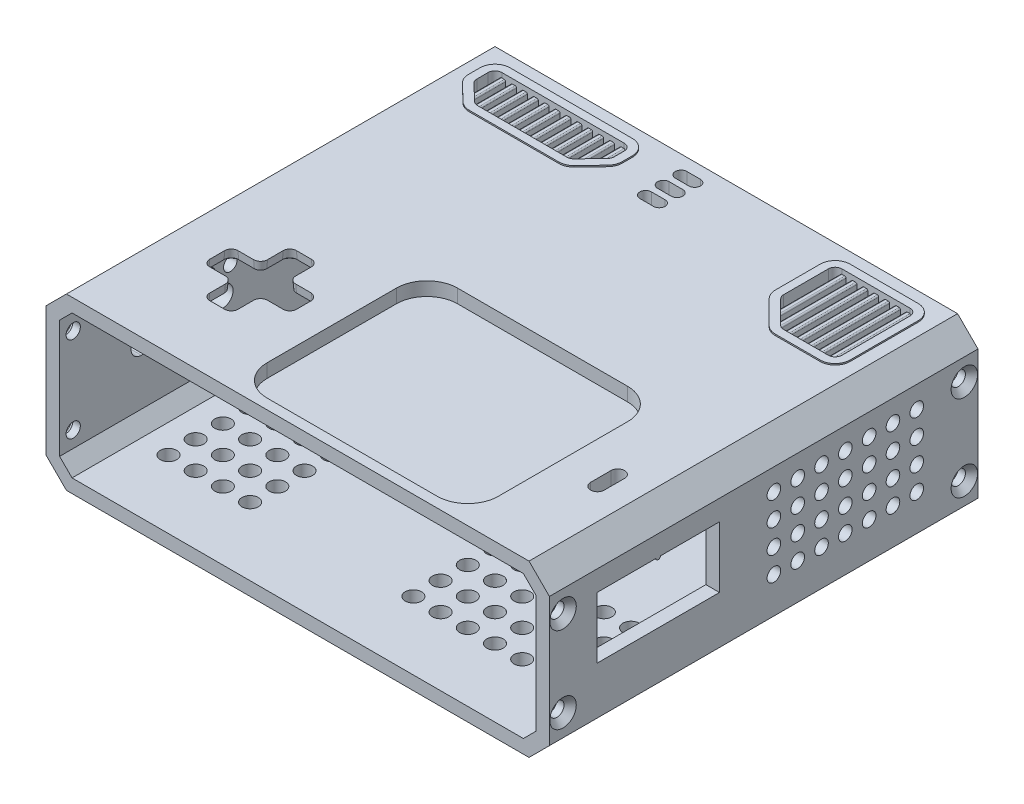
from build123d import *

# Parameters (mm, degrees)
SKETCH_1_W                         = 74
SKETCH_1_H                         = 63
EXTRUDE_1_DEPTH                    = 25
CHAMFER_1_SIZE                     = 3
CUT_EXTRUDE_1_DEPTH                = 78.238017391
CUT_EXTRUDE_2_REACH                = 67.167
SKETCH_6_R                         = 1.05
CUT_EXTRUDE_4_DEPTH                = 92.384239478
CHAMFER_2_SIZE                     = 0.9
CUT_EXTRUDE_5_REACH                = 67.167
CUT_EXTRUDE_6_REACH                = 93.384
CUT_EXTRUDE_7_REACH                = 93.384
SKETCH_9_W                         = 4
SKETCH_9_H                         = 2
FILLET_1_R                         = 1
SKETCH_10_R                        = 1
CUT_EXTRUDE_8_DEPTH                = 2
CUT_EXTRUDE_9_REACH                = 93.384
SKETCH_11_W                        = 18
SKETCH_11_H                        = 9
SKETCH_12_W                        = 2
SKETCH_12_H                        = 7
EXTRUDE_2_DEPTH                    = 20
CHAMFER_3_SIZE                     = 6
SKETCH_13_W                        = 66.34314575
SKETCH_13_H                        = 7
CUT_EXTRUDE_10_DEPTH               = 10
SKETCH_15_R                        = 1
CUT_EXTRUDE_12_DEPTH               = 2
SKETCH_16_W                        = 2
SKETCH_16_H                        = 3
EXTRUDE_3_DEPTH                    = 4
SKETCH_18_R                        = 1.2
CUT_EXTRUDE_13_DEPTH               = 65.426629242
SKETCH_19_R                        = 0.325
EXTRUDE_4_DEPTH                    = 2
EXTRUDE_5_DEPTH                    = 0.2
CUT_EXTRUDE_START                  = -2
CUT_EXTRUDE_15_DEPTH               = 2
SKETCH_23_W                        = 0.8
SKETCH_23_H                        = 13.273646536
SKETCH_23_H_2                      = 8.723645734
EXTRUDE_6_DEPTH                    = 1.5
FILLET_2_R                         = 0.2
CUT_EXTRUDE_16_REACH               = 67.167
JOYBTN_CLEARANCE_0_15MM_5DEG_DEPTH = 2.2
JOYBTN_CLEARANCE_0_15MM_5DEG_DRAFT = 5
CUT_EXTRUDE_18_DEPTH               = 0.8
CUT_EXTRUDE_18_DRAFT               = -26


with BuildPart() as part:
    # 草图1 → 凸台-拉伸1 (new body)
    with BuildSketch(Plane(origin=(0, 0, 0), x_dir=(1, 0, 0), z_dir=(0, 1, 0))):
        with Locations((0.036621478, 15.935)):
            Rectangle(SKETCH_1_W, SKETCH_1_H)
    extrude(amount=EXTRUDE_1_DEPTH)

    # 倒角1
    chamfer_1_edges = [part.edges().sort_by_distance(p)[0] for p in [
        (37.036621478, 25, -15.935),
        (-36.963378522, 25, -15.935),
        (37.036621478, 0, -15.935),
        (-36.963378522, 0, -15.935),
    ]]
    chamfer(chamfer_1_edges, length=CHAMFER_1_SIZE)

    # 草图2 → 切除-拉伸1 (cut, through all)
    with BuildSketch(Plane.XY.offset(15.565)):
        Polygon((-33.134951397, 2), (33.208194353, 2), (35.036621478, 3.828427125), (35.036621478, 21.171572875), (33.208194353, 23), (-33.134951397, 23), (-34.963378522, 21.171572875), (-34.963378522, 3.828427125), align=None)
    extrude(amount=-CUT_EXTRUDE_1_DEPTH, mode=Mode.SUBTRACT)

    # 草图4 → 切除-拉伸2 (cut, up to next)
    with BuildSketch(Plane(origin=(0, 25, 0), x_dir=(1, 0, 0), z_dir=(0, 1, 0)), mode=Mode.PRIVATE) as cut_extrude_2_sk1:
        with BuildLine():
            Line((-5.963378522, 13.935), (19.036621478, 13.935))
            ThreePointArc((19.036621478, 13.935), (22.218601993, 12.616980515), (23.536621478, 9.435))
            Line((23.536621478, 9.435), (23.536621478, -9.565))
            ThreePointArc((23.536621478, -9.565), (22.218601993, -12.746980515), (19.036621478, -14.065))
            Line((19.036621478, -14.065), (-5.963378522, -14.065))
            ThreePointArc((-5.963378522, -14.065), (-9.145359037, -12.746980515), (-10.463378522, -9.565))
            Line((-10.463378522, -9.565), (-10.463378522, 9.435))
            ThreePointArc((-10.463378522, 9.435), (-9.145359037, 12.616980515), (-5.963378522, 13.935))
        make_face()
    cut_extrude_2_tool1 = extrude(cut_extrude_2_sk1.sketch, amount=-CUT_EXTRUDE_2_REACH, mode=Mode.PRIVATE) & part.part
    add(cut_extrude_2_tool1.solids().sort_by_distance((6.536621, 25, 0.065))[0], mode=Mode.SUBTRACT)

    # 草图6 → 切除-拉伸4 (cut, through all)
    with BuildSketch(Plane(origin=(37.036621478, 0, 0), x_dir=(0, 0, -1), z_dir=(1, 0, 0))):
        with Locations((-13.565, 18.8)):
            Circle(SKETCH_6_R)
        with Locations((-13.565, 6.2)):
            Circle(SKETCH_6_R)
        with Locations((45.435, 6.2)):
            Circle(SKETCH_6_R)
        with Locations((45.435, 18.8)):
            Circle(SKETCH_6_R)
    extrude(amount=-CUT_EXTRUDE_4_DEPTH, mode=Mode.SUBTRACT)

    # 倒角2
    chamfer_2_edges = [part.edges().sort_by_distance(p)[0] for p in [
        (-36.963378522, 18.8, -44.385),
        (37.036621478, 18.8, -44.385),
        (-36.963378522, 6.2, -44.385),
        (37.036621478, 6.2, -44.385),
        (-36.963378522, 6.2, 14.615),
        (37.036621478, 6.2, 14.615),
        (-36.963378522, 18.8, 14.615),
        (37.036621478, 18.8, 14.615),
    ]]
    chamfer(chamfer_2_edges, length=CHAMFER_2_SIZE)

    # 草图7 → 切除-拉伸5 (cut, up to next)
    with BuildSketch(Plane(origin=(0, 25, 0), x_dir=(1, 0, 0), z_dir=(0, 1, 0)), mode=Mode.PRIVATE) as cut_extrude_5_sk1:
        with BuildLine():
            Line((30.536621478, 1.9890604), (30.536621478, -1.0109396))
            ThreePointArc((30.536621478, -1.0109396), (29.536621478, -2.0109396), (28.536621478, -1.0109396))
            Line((28.536621478, -1.0109396), (28.536621478, 1.9890604))
            ThreePointArc((28.536621478, 1.9890604), (29.536621478, 2.9890604), (30.536621478, 1.9890604))
        make_face()
    cut_extrude_5_tool1 = extrude(cut_extrude_5_sk1.sketch, amount=-CUT_EXTRUDE_5_REACH, mode=Mode.PRIVATE) & part.part
    add(cut_extrude_5_tool1.solids().sort_by_distance((29.536621, 25, -0.48906))[0], mode=Mode.SUBTRACT)

    # 草图8 → 切除-拉伸6 (cut, up to next)
    with BuildSketch(Plane.ZY.offset(36.963378522), mode=Mode.PRIVATE) as cut_extrude_6_sk1:
        with BuildLine():
            Line((-8.435, 13.7), (3.565, 13.7))
            ThreePointArc((3.565, 13.7), (5.065, 12.2), (3.565, 10.7))
            Line((3.565, 10.7), (-8.435, 10.7))
            ThreePointArc((-8.435, 10.7), (-9.935, 12.2), (-8.435, 13.7))
        make_face()
    cut_extrude_6_tool1 = extrude(cut_extrude_6_sk1.sketch, amount=-CUT_EXTRUDE_6_REACH, mode=Mode.PRIVATE) & part.part
    add(cut_extrude_6_tool1.solids().sort_by_distance((-36.963379, 12.2, -2.435))[0], mode=Mode.SUBTRACT)

    # 草图9 → 切除-拉伸7 (cut, up to next)
    with BuildSketch(Plane.ZY.offset(36.963378522), mode=Mode.PRIVATE) as cut_extrude_7_sk1:
        with Locations((-5.435, 6)):
            Rectangle(SKETCH_9_W, SKETCH_9_H)
    cut_extrude_7_tool1 = extrude(cut_extrude_7_sk1.sketch, amount=-CUT_EXTRUDE_7_REACH, mode=Mode.PRIVATE) & part.part
    add(cut_extrude_7_tool1.solids().sort_by_distance((-36.963379, 6, -5.435))[0], mode=Mode.SUBTRACT)

    # 圆角1
    fillet_1_edges = [part.edges().sort_by_distance(p)[0] for p in [
        (-35.963378522, 5, -3.435),
        (-35.963378522, 7, -3.435),
        (-35.963378522, 7, -7.435),
        (-35.963378522, 5, -7.435),
    ]]
    fillet(fillet_1_edges, radius=FILLET_1_R - 0.0001)  # a hair under: the kernel refuses the full size

    # 草图10 → 切除-拉伸8 (cut)
    with BuildSketch(Plane.ZY.offset(36.963378522)):
        with Locations((6.465, 19)):
            Circle(SKETCH_10_R)
        with Locations((3.265, 19)):
            Circle(SKETCH_10_R)
        with Locations((0.065, 19)):
            Circle(SKETCH_10_R)
        with Locations((-3.135, 19)):
            Circle(SKETCH_10_R)
        with Locations((-6.335, 19)):
            Circle(SKETCH_10_R)
        with Locations((3.265, 15.8)):
            Circle(SKETCH_10_R)
        with Locations((0.065, 15.8)):
            Circle(SKETCH_10_R)
        with Locations((-3.135, 15.8)):
            Circle(SKETCH_10_R)
        with Locations((-6.335, 15.8)):
            Circle(SKETCH_10_R)
        with Locations((6.465, 15.8)):
            Circle(SKETCH_10_R)
        with Locations((-9.535, 19)):
            Circle(SKETCH_10_R)
        with Locations((-12.735, 19)):
            Circle(SKETCH_10_R)
        with Locations((-15.935, 19)):
            Circle(SKETCH_10_R)
        with Locations((-19.135, 19)):
            Circle(SKETCH_10_R)
        with Locations((-22.335, 19)):
            Circle(SKETCH_10_R)
        with Locations((-25.535, 19)):
            Circle(SKETCH_10_R)
        with Locations((-28.735, 19)):
            Circle(SKETCH_10_R)
        with Locations((-31.935, 19)):
            Circle(SKETCH_10_R)
        with Locations((-35.135, 19)):
            Circle(SKETCH_10_R)
        with Locations((-38.335, 19)):
            Circle(SKETCH_10_R)
        with Locations((-9.535, 15.8)):
            Circle(SKETCH_10_R)
        with Locations((-12.735, 15.8)):
            Circle(SKETCH_10_R)
        with Locations((-15.935, 15.8)):
            Circle(SKETCH_10_R)
        with Locations((-19.135, 15.8)):
            Circle(SKETCH_10_R)
        with Locations((-22.335, 15.8)):
            Circle(SKETCH_10_R)
        with Locations((-25.535, 15.8)):
            Circle(SKETCH_10_R)
        with Locations((-28.735, 15.8)):
            Circle(SKETCH_10_R)
        with Locations((-31.935, 15.8)):
            Circle(SKETCH_10_R)
        with Locations((-35.135, 15.8)):
            Circle(SKETCH_10_R)
        with Locations((-38.335, 15.8)):
            Circle(SKETCH_10_R)
    extrude(amount=-CUT_EXTRUDE_8_DEPTH, mode=Mode.SUBTRACT)

    # 草图11 → 切除-拉伸9 (cut, up to next)
    with BuildSketch(Plane(origin=(37.036621478, 0, 0), x_dir=(0, 0, -1), z_dir=(1, 0, 0)), mode=Mode.PRIVATE) as cut_extrude_9_sk1:
        with Locations((0.435, 14.5)):
            Rectangle(SKETCH_11_W, SKETCH_11_H)
    cut_extrude_9_tool1 = extrude(cut_extrude_9_sk1.sketch, amount=-CUT_EXTRUDE_9_REACH, mode=Mode.PRIVATE) & part.part
    add(cut_extrude_9_tool1.solids().sort_by_distance((37.036621, 14.5, -0.435))[0], mode=Mode.SUBTRACT)

    # 草图12 → 凸台-拉伸2 (add)
    with BuildSketch(Plane(origin=(0, 0, -47.435), x_dir=(-1, 0, 0), z_dir=(0, 0, -1))):
        with Locations((25.963378522, 19.5)):
            Rectangle(SKETCH_12_W, SKETCH_12_H)
        with Locations((-16.036621478, 19.5)):
            Rectangle(SKETCH_12_W, SKETCH_12_H)
    extrude(amount=-EXTRUDE_2_DEPTH)

    # 倒角3
    chamfer_3_edges = [part.edges().sort_by_distance(p)[0] for p in [
        (-25.963378522, 16, -27.435),
        (16.036621478, 16, -27.435),
    ]]
    chamfer(chamfer_3_edges, length=CHAMFER_3_SIZE)

    # 草图13 → 切除-拉伸10 (cut)
    with BuildSketch(Plane(origin=(0, 0, -47.435), x_dir=(-1, 0, 0), z_dir=(0, 0, -1))):
        with Locations((-0.036621478, 19.5)):
            Rectangle(SKETCH_13_W, SKETCH_13_H)
    extrude(amount=-CUT_EXTRUDE_10_DEPTH, mode=Mode.SUBTRACT)

    # 草图15 → 切除-拉伸12 (cut)
    with BuildSketch(Plane(origin=(37.036621478, 0, 0), x_dir=(0, 0, -1), z_dir=(1, 0, 0))):
        with Locations((38.435, 18.8)):
            Circle(SKETCH_15_R)
        with Locations((34.935, 18.8)):
            Circle(SKETCH_15_R)
        with Locations((31.435, 18.8)):
            Circle(SKETCH_15_R)
        with Locations((27.935, 18.8)):
            Circle(SKETCH_15_R)
        with Locations((24.435, 18.8)):
            Circle(SKETCH_15_R)
        with Locations((20.935, 18.8)):
            Circle(SKETCH_15_R)
        with Locations((17.435, 18.8)):
            Circle(SKETCH_15_R)
        with Locations((34.935, 15.3)):
            Circle(SKETCH_15_R)
        with Locations((31.435, 15.3)):
            Circle(SKETCH_15_R)
        with Locations((27.935, 15.3)):
            Circle(SKETCH_15_R)
        with Locations((24.435, 15.3)):
            Circle(SKETCH_15_R)
        with Locations((20.935, 15.3)):
            Circle(SKETCH_15_R)
        with Locations((17.435, 15.3)):
            Circle(SKETCH_15_R)
        with Locations((34.935, 11.8)):
            Circle(SKETCH_15_R)
        with Locations((31.435, 11.8)):
            Circle(SKETCH_15_R)
        with Locations((27.935, 11.8)):
            Circle(SKETCH_15_R)
        with Locations((24.435, 11.8)):
            Circle(SKETCH_15_R)
        with Locations((20.935, 11.8)):
            Circle(SKETCH_15_R)
        with Locations((17.435, 11.8)):
            Circle(SKETCH_15_R)
        with Locations((34.935, 8.3)):
            Circle(SKETCH_15_R)
        with Locations((31.435, 8.3)):
            Circle(SKETCH_15_R)
        with Locations((27.935, 8.3)):
            Circle(SKETCH_15_R)
        with Locations((24.435, 8.3)):
            Circle(SKETCH_15_R)
        with Locations((20.935, 8.3)):
            Circle(SKETCH_15_R)
        with Locations((17.435, 8.3)):
            Circle(SKETCH_15_R)
        with Locations((38.435, 15.3)):
            Circle(SKETCH_15_R)
        with Locations((38.435, 11.8)):
            Circle(SKETCH_15_R)
        with Locations((38.435, 8.3)):
            Circle(SKETCH_15_R)
    extrude(amount=-CUT_EXTRUDE_12_DEPTH, mode=Mode.SUBTRACT)

    # 草图16 → 凸台-拉伸3 (add)
    with BuildSketch(Plane.XZ.offset(-23)):
        with Locations((-27.599018842, -17.035)):
            Rectangle(SKETCH_16_W, SKETCH_16_H)
        with Locations((27.668194353, -17.035)):
            Rectangle(SKETCH_16_W, SKETCH_16_H)
    extrude(amount=EXTRUDE_3_DEPTH)

    # 草图18 → 切除-拉伸13 (cut, through all)
    with BuildSketch(Plane(origin=(0, 2, 0), x_dir=(1, 0, 0), z_dir=(0, 1, 0))):
        with Locations(Location((27.036621478, 6.435, 0), (0, 0, 270))):
            Circle(SKETCH_18_R)
        with Locations(Location((23.036621478, 6.435, 0), (0, 0, 270))):
            Circle(SKETCH_18_R)
        with Locations(Location((19.036621478, 6.435, 0), (0, 0, 270))):
            Circle(SKETCH_18_R)
        with Locations(Location((15.036621478, 6.435, 0), (0, 0, 270))):
            Circle(SKETCH_18_R)
        with Locations(Location((11.036621478, 6.435, 0), (0, 0, 270))):
            Circle(SKETCH_18_R)
        with Locations(Location((7.036621478, 6.435, 0), (0, 0, 270))):
            Circle(SKETCH_18_R)
        with Locations(Location((23.036621478, 2.435, 0), (0, 0, 270))):
            Circle(SKETCH_18_R)
        with Locations(Location((19.036621478, 2.435, 0), (0, 0, 270))):
            Circle(SKETCH_18_R)
        with Locations(Location((15.036621478, 2.435, 0), (0, 0, 270))):
            Circle(SKETCH_18_R)
        with Locations(Location((11.036621478, 2.435, 0), (0, 0, 270))):
            Circle(SKETCH_18_R)
        with Locations(Location((7.036621478, 2.435, 0), (0, 0, 270))):
            Circle(SKETCH_18_R)
        with Locations(Location((23.036621478, -1.565, 0), (0, 0, 270))):
            Circle(SKETCH_18_R)
        with Locations(Location((19.036621478, -1.565, 0), (0, 0, 270))):
            Circle(SKETCH_18_R)
        with Locations(Location((15.036621478, -1.565, 0), (0, 0, 270))):
            Circle(SKETCH_18_R)
        with Locations(Location((11.036621478, -1.565, 0), (0, 0, 270))):
            Circle(SKETCH_18_R)
        with Locations(Location((7.036621478, -1.565, 0), (0, 0, 270))):
            Circle(SKETCH_18_R)
        with Locations(Location((23.036621478, -5.565, 0), (0, 0, 270))):
            Circle(SKETCH_18_R)
        with Locations(Location((19.036621478, -5.565, 0), (0, 0, 270))):
            Circle(SKETCH_18_R)
        with Locations(Location((15.036621478, -5.565, 0), (0, 0, 270))):
            Circle(SKETCH_18_R)
        with Locations(Location((11.036621478, -5.565, 0), (0, 0, 270))):
            Circle(SKETCH_18_R)
        with Locations(Location((7.036621478, -5.565, 0), (0, 0, 270))):
            Circle(SKETCH_18_R)
        with Locations(Location((27.036621478, 2.435, 0), (0, 0, 270))):
            Circle(SKETCH_18_R)
        with Locations(Location((27.036621478, -1.565, 0), (0, 0, 270))):
            Circle(SKETCH_18_R)
        with Locations(Location((27.036621478, -5.565, 0), (0, 0, 270))):
            Circle(SKETCH_18_R)
        with Locations(Location((-16.963378522, 6.435, 0), (0, 0, 270))):
            Circle(SKETCH_18_R)
        with Locations(Location((-20.963378522, 6.435, 0), (0, 0, 270))):
            Circle(SKETCH_18_R)
        with Locations(Location((-24.963378522, 6.435, 0), (0, 0, 270))):
            Circle(SKETCH_18_R)
        with Locations(Location((-20.963378522, 2.435, 0), (0, 0, 270))):
            Circle(SKETCH_18_R)
        with Locations(Location((-24.963378522, 2.435, 0), (0, 0, 270))):
            Circle(SKETCH_18_R)
        with Locations(Location((-20.963378522, -1.565, 0), (0, 0, 270))):
            Circle(SKETCH_18_R)
        with Locations(Location((-24.963378522, -1.565, 0), (0, 0, 270))):
            Circle(SKETCH_18_R)
        with Locations(Location((-20.963378522, -5.565, 0), (0, 0, 270))):
            Circle(SKETCH_18_R)
        with Locations(Location((-24.963378522, -5.565, 0), (0, 0, 270))):
            Circle(SKETCH_18_R)
        with Locations(Location((-16.963378522, 2.435, 0), (0, 0, 270))):
            Circle(SKETCH_18_R)
        with Locations(Location((-16.963378522, -1.565, 0), (0, 0, 270))):
            Circle(SKETCH_18_R)
        with Locations(Location((-16.963378522, -5.565, 0), (0, 0, 270))):
            Circle(SKETCH_18_R)
        with Locations(Location((-28.963378522, 6.435, 0), (0, 0, 270))):
            Circle(SKETCH_18_R)
        with Locations(Location((-28.963378522, 2.435, 0), (0, 0, 270))):
            Circle(SKETCH_18_R)
        with Locations(Location((-28.963378522, -1.565, 0), (0, 0, 270))):
            Circle(SKETCH_18_R)
        with Locations(Location((-28.963378522, -5.565, 0), (0, 0, 270))):
            Circle(SKETCH_18_R)
    extrude(amount=-CUT_EXTRUDE_13_DEPTH, mode=Mode.SUBTRACT)

    # 草图19 → 凸台-拉伸4 (add)
    with BuildSketch(Plane(origin=(37.036621478, 0, 0), x_dir=(0, 0, -1), z_dir=(1, 0, 0))):
        with Locations((0.435, 19)):
            Circle(SKETCH_19_R)
    extrude(amount=-EXTRUDE_4_DEPTH)

    # 草图21 → 凸台-拉伸5 (add)
    # profile 1 of 2: a face of its own
    with BuildSketch(Plane(origin=(0, 25, 0), x_dir=(1, 0, 0), z_dir=(0, 1, 0))):
        with BuildLine():
            Line((-11.963378522, 45.635), (-29.963378522, 45.635))
            ThreePointArc((-29.963378522, 45.635), (-31.519013441, 44.990634919), (-32.163378522, 43.435))
            Line((-32.163378522, 43.435), (-32.163378522, 41.755780742))
            ThreePointArc((-32.163378522, 41.755780742), (-31.9875052, 40.893857782), (-31.488004713, 40.169743234))
            Line((-31.488004713, 40.169743234), (-29.073743874, 37.848962491))
            ThreePointArc((-29.073743874, 37.848962491), (-28.370919813, 37.394254729), (-27.549117683, 37.235))
            Line((-27.549117683, 37.235), (-14.377639361, 37.235))
            ThreePointArc((-14.377639361, 37.235), (-13.5157164, 37.410873322), (-12.791601853, 37.910373809))
            Line((-12.791601853, 37.910373809), (-10.377341014, 40.421880085))
            ThreePointArc((-10.377341014, 40.421880085), (-9.922633251, 41.124704146), (-9.763378522, 41.946506276))
            Line((-9.763378522, 41.946506276), (-9.763378522, 43.435))
            ThreePointArc((-9.763378522, 43.435), (-10.407743603, 44.990634919), (-11.963378522, 45.635))
        make_face()
        with BuildLine():
            Line((-11.963378522, 44.435), (-29.963378522, 44.435))
            ThreePointArc((-29.963378522, 44.435), (-30.670485303, 44.142106781), (-30.963378522, 43.435))
            Line((-30.963378522, 43.435), (-30.963378522, 41.755780742))
            ThreePointArc((-30.963378522, 41.755780742), (-30.883436103, 41.363997578), (-30.656390427, 41.034854602))
            Line((-30.656390427, 41.034854602), (-28.242129588, 38.71407386))
            ThreePointArc((-28.242129588, 38.71407386), (-27.922664106, 38.507388513), (-27.549117683, 38.435))
            Line((-27.549117683, 38.435), (-14.377639361, 38.435))
            ThreePointArc((-14.377639361, 38.435), (-13.985856197, 38.514942419), (-13.656713221, 38.741988095))
            Line((-13.656713221, 38.741988095), (-11.242452382, 41.253494371))
            ThreePointArc((-11.242452382, 41.253494371), (-11.035767035, 41.572959853), (-10.963378522, 41.946506276))
            Line((-10.963378522, 41.946506276), (-10.963378522, 43.435))
            ThreePointArc((-10.963378522, 43.435), (-11.256271741, 44.142106781), (-11.963378522, 44.435))
        make_face(mode=Mode.SUBTRACT)
    # profile 2 of 2: a face of its own
    with BuildSketch(Plane(origin=(0, 25, 0), x_dir=(1, 0, 0), z_dir=(0, 1, 0))):
        with BuildLine():
            Line((32.236621478, 43.435), (32.236621478, 33.435))
            ThreePointArc((32.236621478, 33.435), (31.592256397, 31.879365081), (30.036621478, 31.235))
            Line((30.036621478, 31.235), (23.45083504, 31.235))
            ThreePointArc((23.45083504, 31.235), (22.608931489, 31.402465028), (21.895200122, 31.879365081))
            Line((21.895200122, 31.879365081), (18.480986559, 35.293578644))
            ThreePointArc((18.480986559, 35.293578644), (18.004086506, 36.007310011), (17.836621478, 36.849213562))
            Line((17.836621478, 36.849213562), (17.836621478, 43.435))
            ThreePointArc((17.836621478, 43.435), (18.480986559, 44.990634919), (20.036621478, 45.635))
            Line((20.036621478, 45.635), (30.036621478, 45.635))
            ThreePointArc((30.036621478, 45.635), (31.592256397, 44.990634919), (32.236621478, 43.435))
        make_face()
        with BuildLine():
            Line((31.036621478, 43.435), (31.036621478, 33.435))
            ThreePointArc((31.036621478, 33.435), (30.743728259, 32.727893219), (30.036621478, 32.435))
            Line((30.036621478, 32.435), (23.45083504, 32.435))
            ThreePointArc((23.45083504, 32.435), (23.068151608, 32.511120467), (22.743728259, 32.727893219))
            Line((22.743728259, 32.727893219), (19.329514697, 36.142106781))
            ThreePointArc((19.329514697, 36.142106781), (19.112741945, 36.46653013), (19.036621478, 36.849213562))
            Line((19.036621478, 36.849213562), (19.036621478, 43.435))
            ThreePointArc((19.036621478, 43.435), (19.329514697, 44.142106781), (20.036621478, 44.435))
            Line((20.036621478, 44.435), (30.036621478, 44.435))
            ThreePointArc((30.036621478, 44.435), (30.743728259, 44.142106781), (31.036621478, 43.435))
        make_face(mode=Mode.SUBTRACT)
    extrude(amount=EXTRUDE_5_DEPTH)

    # 草图22 → 切除-拉伸15 (cut)
    with BuildSketch(Plane(origin=(0, 25, 0), x_dir=(1, 0, 0), z_dir=(0, 1, 0)).offset(CUT_EXTRUDE_START)):
        with BuildLine():
            Line((-13.656713221, 38.741988095), (-11.242452382, 41.253494371))
            ThreePointArc((-11.242452382, 41.253494371), (-11.035767035, 41.572959853), (-10.963378522, 41.946506276))
            Line((-10.963378522, 41.946506276), (-10.963378522, 43.435))
            ThreePointArc((-10.963378522, 43.435), (-11.256271741, 44.142106781), (-11.963378522, 44.435))
            Line((-11.963378522, 44.435), (-29.963378522, 44.435))
            ThreePointArc((-29.963378522, 44.435), (-30.670485303, 44.142106781), (-30.963378522, 43.435))
            Line((-30.963378522, 43.435), (-30.963378522, 41.755780742))
            ThreePointArc((-30.963378522, 41.755780742), (-30.883436103, 41.363997578), (-30.656390427, 41.034854602))
            Line((-30.656390427, 41.034854602), (-28.242129588, 38.71407386))
            ThreePointArc((-28.242129588, 38.71407386), (-27.922664106, 38.507388513), (-27.549117683, 38.435))
            Line((-27.549117683, 38.435), (-14.377639361, 38.435))
            ThreePointArc((-14.377639361, 38.435), (-13.985856197, 38.514942419), (-13.656713221, 38.741988095))
        make_face()
        with BuildLine():
            Line((30.036621478, 44.435), (20.036621478, 44.435))
            ThreePointArc((20.036621478, 44.435), (19.329514697, 44.142106781), (19.036621478, 43.435))
            Line((19.036621478, 43.435), (19.036621478, 36.849213562))
            ThreePointArc((19.036621478, 36.849213562), (19.112741945, 36.46653013), (19.329514697, 36.142106781))
            Line((19.329514697, 36.142106781), (22.743728259, 32.727893219))
            ThreePointArc((22.743728259, 32.727893219), (23.068151608, 32.511120467), (23.45083504, 32.435))
            Line((23.45083504, 32.435), (30.036621478, 32.435))
            ThreePointArc((30.036621478, 32.435), (30.743728259, 32.727893219), (31.036621478, 33.435))
            Line((31.036621478, 33.435), (31.036621478, 43.435))
            ThreePointArc((31.036621478, 43.435), (30.743728259, 44.142106781), (30.036621478, 44.435))
        make_face()
    extrude(amount=CUT_EXTRUDE_15_DEPTH, mode=Mode.SUBTRACT)

    # 草图23 → 凸台-拉伸6 (add)
    with BuildSketch(Plane(origin=(0, 24.5, 0), x_dir=(1, 0, 0), z_dir=(0, 1, 0))):
        with Locations((28.236621478, 39.089661721)):
            Rectangle(SKETCH_23_W, SKETCH_23_H)
        with Locations((29.836621478, 39.089661721)):
            Rectangle(SKETCH_23_W, SKETCH_23_H)
        with Locations((26.636621478, 39.089661721)):
            Rectangle(SKETCH_23_W, SKETCH_23_H)
        with Locations((25.036621478, 39.089661721)):
            Rectangle(SKETCH_23_W, SKETCH_23_H)
        with Locations((23.436621478, 39.089661721)):
            Rectangle(SKETCH_23_W, SKETCH_23_H)
        with Locations((21.836621478, 39.089661721)):
            Rectangle(SKETCH_23_W, SKETCH_23_H)
        with Locations((20.236621478, 39.089661721)):
            Rectangle(SKETCH_23_W, SKETCH_23_H)
        with Locations((-13.799353953, 42.090509087)):
            Rectangle(SKETCH_23_W, SKETCH_23_H_2)
        with Locations((-12.199353953, 42.090509087)):
            Rectangle(SKETCH_23_W, SKETCH_23_H_2)
        with Locations((-15.399353953, 42.090509087)):
            Rectangle(SKETCH_23_W, SKETCH_23_H_2)
        with Locations((-16.999353953, 42.090509087)):
            Rectangle(SKETCH_23_W, SKETCH_23_H_2)
        with Locations((-18.599353953, 42.090509087)):
            Rectangle(SKETCH_23_W, SKETCH_23_H_2)
        with Locations((-20.199353953, 42.090509087)):
            Rectangle(SKETCH_23_W, SKETCH_23_H_2)
        with Locations((-21.799353953, 42.090509087)):
            Rectangle(SKETCH_23_W, SKETCH_23_H_2)
        with Locations((-23.399353953, 42.090509087)):
            Rectangle(SKETCH_23_W, SKETCH_23_H_2)
        with Locations((-24.999353953, 42.090509087)):
            Rectangle(SKETCH_23_W, SKETCH_23_H_2)
        with Locations((-26.599353953, 42.090509087)):
            Rectangle(SKETCH_23_W, SKETCH_23_H_2)
        with Locations((-28.199353953, 42.090509087)):
            Rectangle(SKETCH_23_W, SKETCH_23_H_2)
        with Locations((-29.799353953, 42.090509087)):
            Rectangle(SKETCH_23_W, SKETCH_23_H_2)
    extrude(amount=-EXTRUDE_6_DEPTH)

    # 圆角2
    fillet_2_edges = [part.edges().sort_by_distance(p)[0] for p in [
        (-28.599353953, 24.5, -41.746233255),
        (-27.799353953, 24.5, -41.450907599),
        (-26.999353953, 24.5, -41.435),
        (-26.199353953, 24.5, -41.435),
        (-25.399353953, 24.5, -41.435),
        (-24.599353953, 24.5, -41.435),
        (-23.799353953, 24.5, -41.435),
        (-22.999353953, 24.5, -41.435),
        (-22.199353953, 24.5, -41.435),
        (-21.399353953, 24.5, -41.435),
        (-20.599353953, 24.5, -41.435),
        (-19.799353953, 24.5, -41.435),
        (-18.999353953, 24.5, -41.435),
        (-18.199353953, 24.5, -41.435),
        (-17.399353953, 24.5, -41.435),
        (-16.599353953, 24.5, -41.435),
        (-15.799353953, 24.5, -41.435),
        (-14.999353953, 24.5, -41.435),
        (-14.199353953, 24.5, -41.443010591),
        (-13.399353953, 24.5, -41.722356844),
        (-12.599353953, 24.5, -42.13846868),
        (-11.799353953, 24.5, -42.547808643),
        (-30.199353953, 24.5, -42.501136793),
        (19.836621478, 24.5, -40.024897949),
        (20.636621478, 24.5, -39.635),
        (21.436621478, 24.5, -39.235),
        (22.236621478, 24.5, -38.835),
        (23.036621478, 24.5, -38.479910139),
        (23.836621478, 24.5, -38.443919227),
        (24.636621478, 24.5, -38.443919227),
        (25.436621478, 24.5, -38.443919227),
        (26.236621478, 24.5, -38.443919227),
        (27.036621478, 24.5, -38.443919227),
        (27.836621478, 24.5, -38.443919227),
        (28.636621478, 24.5, -38.443919227),
        (29.436621478, 24.5, -38.443919227),
        (30.236621478, 24.5, -38.435),
        (-29.399353953, 24.5, -42.130745269),
    ]]
    fillet(fillet_2_edges, radius=FILLET_2_R)

    # 草图24 → 切除-拉伸16 (cut, up to next)
    with BuildSketch(Plane(origin=(0, 25, 0), x_dir=(1, 0, 0), z_dir=(0, 1, 0)), mode=Mode.PRIVATE) as cut_extrude_16_sk1:
        with BuildLine():
            Line((-3.963378522, 45.635), (-1.963378522, 45.635))
            ThreePointArc((-1.963378522, 45.635), (-1.113378522, 44.785), (-1.963378522, 43.935))
            Line((-1.963378522, 43.935), (-3.963378522, 43.935))
            ThreePointArc((-3.963378522, 43.935), (-4.813378522, 44.785), (-3.963378522, 45.635))
        make_face()
    cut_extrude_16_tool1 = extrude(cut_extrude_16_sk1.sketch, amount=-CUT_EXTRUDE_16_REACH, mode=Mode.PRIVATE) & part.part
    # 草图24 → 切除-拉伸16 (cut, up to next)
    with BuildSketch(Plane(origin=(0, 25, 0), x_dir=(1, 0, 0), z_dir=(0, 1, 0)), mode=Mode.PRIVATE) as cut_extrude_16_sk2:
        with BuildLine():
            Line((-3.963378522, 43.035), (-1.963378522, 43.035))
            ThreePointArc((-1.963378522, 43.035), (-1.113378522, 42.185), (-1.963378522, 41.335))
            Line((-1.963378522, 41.335), (-3.963378522, 41.335))
            ThreePointArc((-3.963378522, 41.335), (-4.813378522, 42.185), (-3.963378522, 43.035))
        make_face()
    cut_extrude_16_tool2 = extrude(cut_extrude_16_sk2.sketch, amount=-CUT_EXTRUDE_16_REACH, mode=Mode.PRIVATE) & part.part
    # 草图24 → 切除-拉伸16 (cut, up to next)
    with BuildSketch(Plane(origin=(0, 25, 0), x_dir=(1, 0, 0), z_dir=(0, 1, 0)), mode=Mode.PRIVATE) as cut_extrude_16_sk3:
        with BuildLine():
            Line((-3.963378522, 40.435), (-1.963378522, 40.435))
            ThreePointArc((-1.963378522, 40.435), (-1.113378522, 39.585), (-1.963378522, 38.735))
            Line((-1.963378522, 38.735), (-3.963378522, 38.735))
            ThreePointArc((-3.963378522, 38.735), (-4.813378522, 39.585), (-3.963378522, 40.435))
        make_face()
    cut_extrude_16_tool3 = extrude(cut_extrude_16_sk3.sketch, amount=-CUT_EXTRUDE_16_REACH, mode=Mode.PRIVATE) & part.part
    add(cut_extrude_16_tool1.solids().sort_by_distance((-2.963379, 25, -44.785))[0], mode=Mode.SUBTRACT)
    add(cut_extrude_16_tool2.solids().sort_by_distance((-2.963379, 25, -42.185))[0], mode=Mode.SUBTRACT)
    add(cut_extrude_16_tool3.solids().sort_by_distance((-2.963379, 25, -39.585))[0], mode=Mode.SUBTRACT)


with BuildPart() as joybtn_clearance_0_15mm_5deg_tool:
    # JoyBtn_offset_profile_0.15mm → JoyBtn_clearance_0.15mm_5deg (with draft: the straight prism first)
    with BuildSketch(Plane(origin=(0, 25, 0), x_dir=(1, 0, 0), z_dir=(0, 1, 0))):
        with BuildLine():
            ThreePointArc((-22.582815493, 6.865211672), (-23.269569882, 6.58074869), (-23.554032864, 5.893994301))
            Line((-23.554032864, 5.893994301), (-23.554032864, 3.586383697))
            ThreePointArc((-23.554032864, 3.586383697), (-23.853127226, 2.864306033), (-24.575204889, 2.565211672))
            Line((-24.575204889, 2.565211672), (-26.882815493, 2.565211672))
            ThreePointArc((-26.882815493, 2.565211672), (-27.569569882, 2.28074869), (-27.854032864, 1.593994301))
            Line((-27.854032864, 1.593994301), (-27.854032864, -0.613616303))
            ThreePointArc((-27.854032864, -0.613616303), (-27.569569882, -1.300370692), (-26.882815493, -1.584833674))
            Line((-26.882815493, -1.584833674), (-24.575204889, -1.584833674))
            ThreePointArc((-24.575204889, -1.584833674), (-23.853127226, -1.883928036), (-23.554032864, -2.606005699))
            Line((-23.554032864, -2.606005699), (-23.554032864, -4.913616303))
            ThreePointArc((-23.554032864, -4.913616303), (-23.269569882, -5.600370692), (-22.582815493, -5.884833674))
            Line((-22.582815493, -5.884833674), (-20.375204889, -5.884833674))
            ThreePointArc((-20.375204889, -5.884833674), (-19.6884505, -5.600370692), (-19.403987518, -4.913616303))
            Line((-19.403987518, -4.913616303), (-19.403987518, -2.606005699))
            ThreePointArc((-19.403987518, -2.606005699), (-19.104893157, -1.883928036), (-18.382815493, -1.584833674))
            Line((-18.382815493, -1.584833674), (-16.075204889, -1.584833674))
            ThreePointArc((-16.075204889, -1.584833674), (-15.3884505, -1.300370692), (-15.103987518, -0.613616303))
            Line((-15.103987518, -0.613616303), (-15.103987518, 1.593994301))
            ThreePointArc((-15.103987518, 1.593994301), (-15.434377379, 2.234821811), (-16.075204889, 2.565211672))
            Line((-16.075204889, 2.565211672), (-18.382815493, 2.565211672))
            ThreePointArc((-18.382815493, 2.565211672), (-19.104893157, 2.864306033), (-19.403987518, 3.586383697))
            Line((-19.403987518, 3.586383697), (-19.403987518, 5.893994301))
            ThreePointArc((-19.403987518, 5.893994301), (-19.6884505, 6.58074869), (-20.375204889, 6.865211672))
            Line((-20.375204889, 6.865211672), (-22.582815493, 6.865211672))
        make_face()
    extrude(amount=-JOYBTN_CLEARANCE_0_15MM_5DEG_DEPTH)
    # JoyBtn_clearance_0.15mm_5deg: the draft: its side faces are tilted about the plane it starts from
    joybtn_clearance_0_15mm_5deg_sides = [joybtn_clearance_0_15mm_5deg_tool.faces().sort_by_distance(p)[0] for p in [
        (-23.269569882, 23.9, -6.58074869),
        (-23.554032864, 23.9, -4.740188999),
        (-23.853127226, 23.9, -2.864306033),
        (-25.729010191, 23.9, -2.565211672),
        (-27.569569882, 23.9, -2.28074869),
        (-27.854032864, 23.9, -0.490188999),
        (-27.569569882, 23.9, 1.300370692),
        (-25.729010191, 23.9, 1.584833674),
        (-23.853127226, 23.9, 1.883928036),
        (-23.554032864, 23.9, 3.759811001),
        (-23.269569882, 23.9, 5.600370692),
        (-21.479010191, 23.9, 5.884833674),
        (-19.6884505, 23.9, 5.600370692),
        (-19.403987518, 23.9, 3.759811001),
        (-19.104893157, 23.9, 1.883928036),
        (-17.229010191, 23.9, 1.584833674),
        (-15.3884505, 23.9, 1.300370692),
        (-15.103987518, 23.9, -0.490188999),
        (-15.434377379, 23.9, -2.234821811),
        (-17.229010191, 23.9, -2.565211672),
        (-19.104893157, 23.9, -2.864306033),
        (-19.403987518, 23.9, -4.740188999),
        (-19.6884505, 23.9, -6.58074869),
        (-21.479010191, 23.9, -6.865211672),
    ]]
    draft(joybtn_clearance_0_15mm_5deg_sides, Plane(origin=(0, 25, 0), x_dir=(1, 0, 0), z_dir=(0, 1, 0)), JOYBTN_CLEARANCE_0_15MM_5DEG_DRAFT)


with BuildPart() as part_1:
    add(part.part)

    # JoyBtn_clearance_0.15mm_5deg: cut by joybtn_clearance_0_15mm_5deg_tool
    add(joybtn_clearance_0_15mm_5deg_tool.part, mode=Mode.SUBTRACT)


with BuildPart() as cut_extrude_18_tool:
    # 草图30 → 切除-拉伸18 (with draft: the straight prism first)
    with BuildSketch(Plane.XZ.offset(-23)):
        with BuildLine():
            Line((-16.075204889, 2.759811001), (-18.229010191, 2.759811001))
            Line((-18.229010191, 2.759811001), (-18.229010191, 4.913616303))
            ThreePointArc((-18.229010191, 4.913616303), (-18.857616065, 6.431205128), (-20.375204889, 7.059811001))
            Line((-20.375204889, 7.059811001), (-22.582815493, 7.059811001))
            ThreePointArc((-22.582815493, 7.059811001), (-24.100404318, 6.431205128), (-24.729010191, 4.913616303))
            Line((-24.729010191, 4.913616303), (-24.729010191, 2.759811001))
            Line((-24.729010191, 2.759811001), (-26.882815493, 2.759811001))
            ThreePointArc((-26.882815493, 2.759811001), (-28.400404318, 2.131205128), (-29.029010191, 0.613616303))
            Line((-29.029010191, 0.613616303), (-29.029010191, -1.593994301))
            ThreePointArc((-29.029010191, -1.593994301), (-28.400404318, -3.111583125), (-26.882815493, -3.740188999))
            Line((-26.882815493, -3.740188999), (-24.729010191, -3.740188999))
            Line((-24.729010191, -3.740188999), (-24.729010191, -5.893994301))
            ThreePointArc((-24.729010191, -5.893994301), (-24.100404318, -7.411583125), (-22.582815493, -8.040188999))
            Line((-22.582815493, -8.040188999), (-20.375204889, -8.040188999))
            ThreePointArc((-20.375204889, -8.040188999), (-18.857616065, -7.411583125), (-18.229010191, -5.893994301))
            Line((-18.229010191, -5.893994301), (-18.229010191, -3.740188999))
            Line((-18.229010191, -3.740188999), (-15.993901073, -3.740188999))
            ThreePointArc((-15.993901073, -3.740188999), (-14.603542943, -3.065656247), (-13.929010191, -1.675298117))
            Line((-13.929010191, -1.675298117), (-13.929010191, 0.613616303))
            ThreePointArc((-13.929010191, 0.613616303), (-14.557616065, 2.131205128), (-16.075204889, 2.759811001))
        make_face()
    extrude(amount=-CUT_EXTRUDE_18_DEPTH)
    # 切除-拉伸18: the draft: its side faces are tilted about the plane it starts from
    cut_extrude_18_sides = [cut_extrude_18_tool.faces().sort_by_distance(p)[0] for p in [
        (-17.15210754, 23.4, 2.759811001),
        (-18.229010191, 23.4, 3.836713652),
        (-18.857616065, 23.4, 6.431205128),
        (-21.479010191, 23.4, 7.059811001),
        (-24.100404318, 23.4, 6.431205128),
        (-24.729010191, 23.4, 3.836713652),
        (-25.805912842, 23.4, 2.759811001),
        (-28.400404318, 23.4, 2.131205128),
        (-29.029010191, 23.4, -0.490188999),
        (-28.400404318, 23.4, -3.111583125),
        (-25.805912842, 23.4, -3.740188999),
        (-24.729010191, 23.4, -4.81709165),
        (-24.100404318, 23.4, -7.411583125),
        (-21.479010191, 23.4, -8.040188999),
        (-18.857616065, 23.4, -7.411583125),
        (-18.229010191, 23.4, -4.81709165),
        (-17.111455632, 23.4, -3.740188999),
        (-14.603542943, 23.4, -3.065656247),
        (-13.929010191, 23.4, -0.530840907),
        (-14.557616065, 23.4, 2.131205128),
    ]]
    draft(cut_extrude_18_sides, Plane.XZ.offset(-23), CUT_EXTRUDE_18_DRAFT)


with BuildPart() as part_2:
    add(part_1.part)

    # 切除-拉伸18: cut by cut_extrude_18_tool
    add(cut_extrude_18_tool.part, mode=Mode.SUBTRACT)


solid = part_2.part
